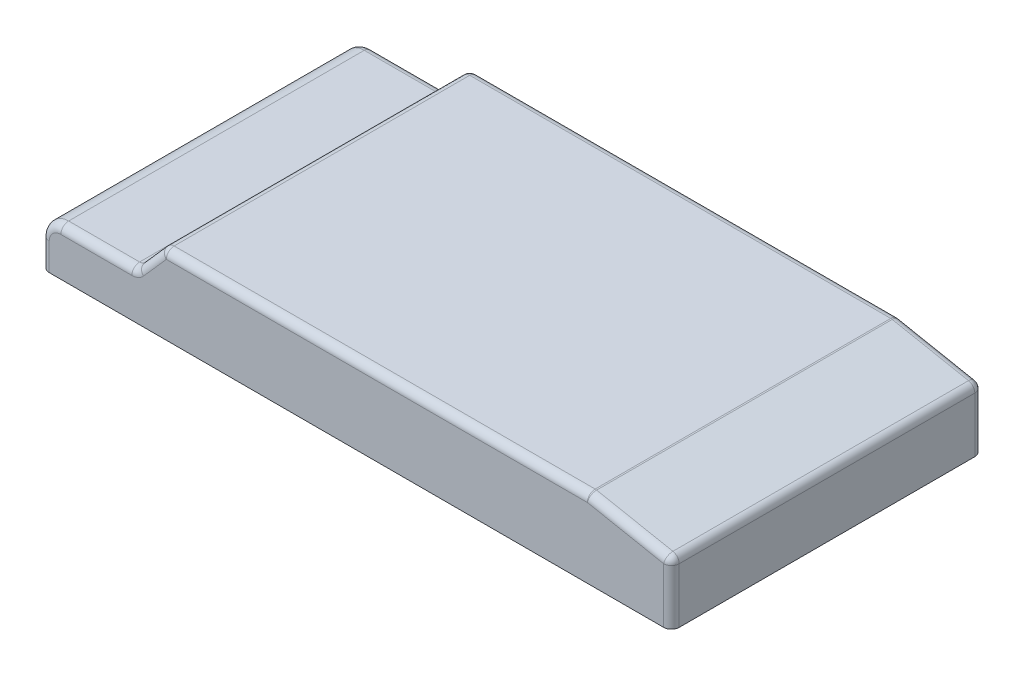
from build123d import *

# Parameters (mm, degrees)
EXTRUDE_THIN1_DEPTH = 101.6
FILLET1_R           = 6.35
FILLET2_R           = 2.54
FILLET3_R           = 2.54
FILLET4_R           = 2.54
FILLET5_R           = 2.54
SKETCH4_W           = 137.085663299
SKETCH4_H           = 88.9
CUT_EXTRUDE1_DEPTH  = 20.32


# Read off the part's stored shape, not the designer's step: Extrude-Thin1
with BuildPart() as part:
    # Extrude-Thin1 outline → Extrude-Thin1 (new body)
    with BuildSketch(Plane.XY):
        Polygon((147.558789547, -4.59991125), (147.558789547, 15.496429633), (120.350988963, 20.80008875), (-18.530121413, 20.80008875), (-27.508924365, 10.64008875), (-58.181210453, 10.64008875), (-58.181210453, -4.59991125), align=None)
    extrude(amount=EXTRUDE_THIN1_DEPTH)

    # Fillet1
    fillet1_edges = [part.edges().sort_by_distance(p)[0] for p in [
        (-58.181210453, 10.64008875, 50.8),
    ]]
    fillet(fillet1_edges, radius=FILLET1_R)

    # Fillet2
    fillet2_edges = [part.edges().sort_by_distance(p)[0] for p in [
        (147.558789547, 15.496429633, 50.8),
    ]]
    fillet(fillet2_edges, radius=FILLET2_R)

    # Fillet3
    fillet3_edges = [part.edges().sort_by_distance(p)[0] for p in [
        (120.350988963, 20.80008875, 50.8),
        (-18.530121413, 20.80008875, 50.8),
    ]]
    fillet(fillet3_edges, radius=FILLET3_R)

    # Fillet4
    fillet4_edges = [part.edges().sort_by_distance(p)[0] for p in [
        (-27.508924365, 10.64008875, 50.8),
    ]]
    fillet(fillet4_edges, radius=FILLET4_R)

    # Fillet5
    fillet5_edges = [part.edges().sort_by_distance(p)[0] for p in [
        (-58.181210453, -0.15491125, 0),
        (-58.181210453, -0.15491125, 101.6),
        (-40.24258292, 10.64008875, 0),
        (-56.321338514, 8.780216811, 0),
        (-40.24258292, 10.64008875, 101.6),
        (-56.321338514, 8.780216811, 101.6),
        (147.558789547, 4.401918308, 0),
        (146.979144977, 15.018866002, 0),
        (147.558789547, 4.401918308, 101.6),
        (146.979144977, 15.018866002, 101.6),
        (133.048240824, 18.324993588, 0),
        (51.360321792, 20.80008875, 0),
        (120.349853607, 20.788330353, 0),
        (-18.428956215, 20.575675963, 0),
        (51.360321792, 20.80008875, 101.6),
        (133.048240824, 18.324993588, 101.6),
        (120.349853607, 20.788330353, 101.6),
        (-18.428956215, 20.575675963, 101.6),
        (-23.019522889, 15.72008875, 101.6),
        (-23.019522889, 15.72008875, 0),
        (-27.610089563, 10.864501537, 0),
        (-27.610089563, 10.864501537, 101.6),
    ]]
    fillet(fillet5_edges, radius=FILLET5_R)

    # Sketch4 → Cut-Extrude1 (cut)
    with BuildSketch(Plane(origin=(0, -4.59991125, 0), x_dir=(-1, 0, 0), z_dir=(0, -1, 0))):
        with Locations((-51.392828597, -50.8)):
            Rectangle(SKETCH4_W, SKETCH4_H)
    extrude(amount=-CUT_EXTRUDE1_DEPTH, mode=Mode.SUBTRACT)


solid = part.part
